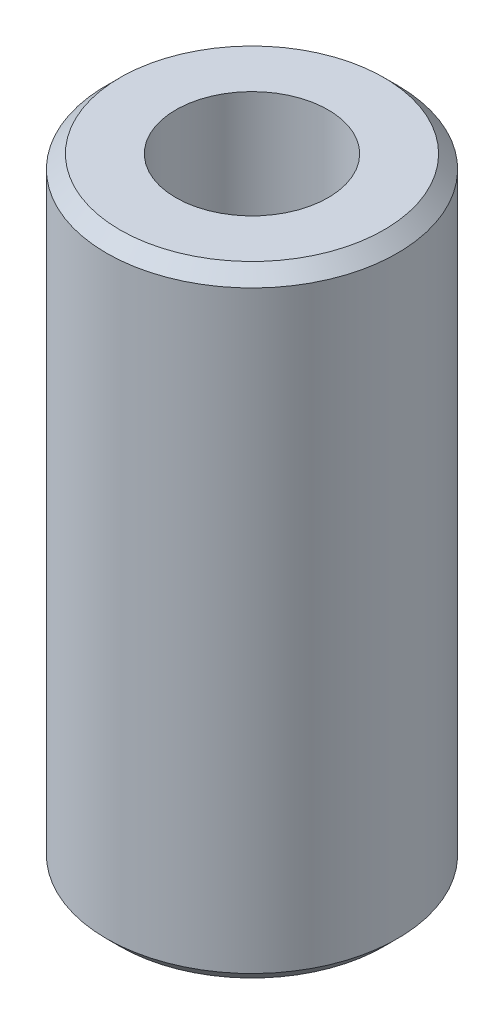
from build123d import *

# Parameters (mm, degrees)
SKETCH1_R           = 47.5
BOSS_EXTRUDE1_DEPTH = 202.711872178
SKETCH2_R           = 24.879541274
CUT_EXTRUDE1_DEPTH  = 214.552342815
CHAMFER1_SIZE       = 4.388717785


with BuildPart() as part:
    # Sketch1 → Boss-Extrude1 (new body)
    with BuildSketch(Plane(origin=(0, 0, 0), x_dir=(1, 0, 0), z_dir=(0, 1, 0))):
        Circle(SKETCH1_R)
    extrude(amount=BOSS_EXTRUDE1_DEPTH)

    # Sketch2 → Cut-Extrude1 (cut, through all)
    with BuildSketch(Plane(origin=(0, 0, 0), x_dir=(1, 0, 0), z_dir=(0, 1, 0))):
        Circle(SKETCH2_R)
    extrude(amount=CUT_EXTRUDE1_DEPTH, mode=Mode.SUBTRACT)

    # Chamfer1
    chamfer1_edges = [part.edges().sort_by_distance(p)[0] for p in [
        (-47.5, 202.711872178, 0),
        (-47.5, 0, 0),
    ]]
    chamfer(chamfer1_edges, length=CHAMFER1_SIZE)


solid = part.part
